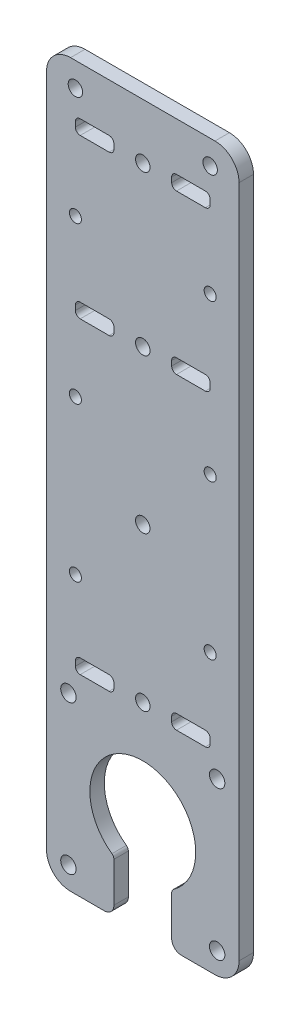
from build123d import *

# Parameters (mm, degrees)
SKETCH1_R                      = 1.6
BOSS_EXTRUDE1_DEPTH            = 3
FILLET1_R                      = 5
FILLET2_R                      = 2
FILLET3_R                      = 1
SKETCH2_W                      = 8
SKETCH2_H                      = 3
SKETCH2_R                      = 1.5
CUT_EXTRUDE1_DEPTH             = 3
FILLET4_R                      = 1
F_2_5_2_5_DIAMETER_HOLE1_D     = 2.5
F_2_5_2_5_DIAMETER_HOLE1_DEPTH = 6
F_2_5_2_5_DIAMETER_HOLE1_TIP   = 0.751075774
SKETCH8_R                      = 1.5
CUT_EXTRUDE2_DEPTH             = 10


with BuildPart() as part:
    # Sketch1 → Boss-Extrude1 (new body)
    with BuildSketch(Plane.XY):
        with BuildLine():
            Line((20, 75), (-20, 75))
            Line((-20, 75), (-20, -75))
            Line((-20, -75), (-6, -75))
            Line((-6, -75), (-6, -64.219544457))
            ThreePointArc((-6, -64.219544457), (-5.244044241, -45.330460197), (11, -55))
            ThreePointArc((11, -55), (9.669539803, -60.244044241), (6, -64.219544457))
            Line((6, -64.219544457), (6, -75))
            Line((6, -75), (20, -75))
            Line((20, -75), (20, 75))
        make_face()
        with Locations((-15.450283169, -70.450283169)):
            Circle(SKETCH1_R, mode=Mode.SUBTRACT)
        with Locations((-15.450283169, -39.549716831)):
            Circle(SKETCH1_R, mode=Mode.SUBTRACT)
        with Locations((15.450283169, -70.450283169)):
            Circle(SKETCH1_R, mode=Mode.SUBTRACT)
        with Locations((15.450283169, -39.549716831)):
            Circle(SKETCH1_R, mode=Mode.SUBTRACT)
    extrude(amount=BOSS_EXTRUDE1_DEPTH)

    # Fillet1
    fillet1_edges = [part.edges().sort_by_distance(p)[0] for p in [
        (-20, -75, 1.5),
        (20, -75, 1.5),
        (-20, 75, 1.5),
        (20, 75, 1.5),
    ]]
    fillet(fillet1_edges, radius=FILLET1_R)

    # Fillet2
    fillet2_edges = [part.edges().sort_by_distance(p)[0] for p in [
        (6, -75, 1.5),
        (-6, -75, 1.5),
    ]]
    fillet(fillet2_edges, radius=FILLET2_R)

    # Fillet3
    fillet3_edges = [part.edges().sort_by_distance(p)[0] for p in [
        (6, -64.219544457, 1.5),
        (-6, -64.219544457, 1.5),
    ]]
    fillet(fillet3_edges, radius=FILLET3_R)

    # Sketch2 → Cut-Extrude1 (cut)
    with BuildSketch(Plane.XY.offset(3)):
        with Locations((-10, 63.5)):
            Rectangle(SKETCH2_W, SKETCH2_H)
        with Locations((10, 63.5)):
            Rectangle(SKETCH2_W, SKETCH2_H)
        with Locations((-10, 30.5)):
            Rectangle(SKETCH2_W, SKETCH2_H)
        with Locations((10, 30.5)):
            Rectangle(SKETCH2_W, SKETCH2_H)
        with Locations((-10, -33.5)):
            Rectangle(SKETCH2_W, SKETCH2_H)
        with Locations((10, -33.5)):
            Rectangle(SKETCH2_W, SKETCH2_H)
        with Locations((0, -33.5)):
            Circle(SKETCH2_R)
        with Locations((0, 30.5)):
            Circle(SKETCH2_R)
        with Locations((0, 63.5)):
            Circle(SKETCH2_R)
        with Locations((0, -1.5)):
            Circle(SKETCH2_R)
    extrude(amount=-CUT_EXTRUDE1_DEPTH, mode=Mode.SUBTRACT)

    # Fillet4
    fillet4_edges = [part.edges().sort_by_distance(p)[0] for p in [
        (-6, 29, 1.5),
        (-14, 29, 1.5),
        (-6, 32, 1.5),
        (14, -35, 1.5),
        (6, -35, 1.5),
        (6, -32, 1.5),
        (14, -32, 1.5),
        (-6, -35, 1.5),
        (-14, -35, 1.5),
        (-14, -32, 1.5),
        (-6, -32, 1.5),
        (14, 29, 1.5),
        (6, 29, 1.5),
        (6, 32, 1.5),
        (14, 32, 1.5),
        (-14, 32, 1.5),
        (14, 65, 1.5),
        (14, 62, 1.5),
        (6, 65, 1.5),
        (6, 62, 1.5),
        (-14, 62, 1.5),
        (-6, 62, 1.5),
        (-6, 65, 1.5),
        (-14, 65, 1.5),
    ]]
    fillet(fillet4_edges, radius=FILLET4_R)

    # Ø2.5 (2.5) Diameter Hole1
    with Locations(Plane.XY.offset(3)):
        with Locations((14, -17.5), (-14, -17.5), (-14, 14.5), (14, 14.5), (14, 47), (-14, 47)):
            Hole(F_2_5_2_5_DIAMETER_HOLE1_D / 2, depth=F_2_5_2_5_DIAMETER_HOLE1_DEPTH)
            with Locations((0, 0, -(F_2_5_2_5_DIAMETER_HOLE1_DEPTH + F_2_5_2_5_DIAMETER_HOLE1_TIP / 2))):  # 118° drill point
                Cone(0, F_2_5_2_5_DIAMETER_HOLE1_D / 2, F_2_5_2_5_DIAMETER_HOLE1_TIP, mode=Mode.SUBTRACT)

    # Sketch8 → Cut-Extrude2 (cut)
    with BuildSketch(Plane.XY.offset(3)):
        with Locations((-14, 70)):
            Circle(SKETCH8_R)
        with Locations((14, 70)):
            Circle(SKETCH8_R)
    extrude(amount=-CUT_EXTRUDE2_DEPTH, mode=Mode.SUBTRACT)


solid = part.part
